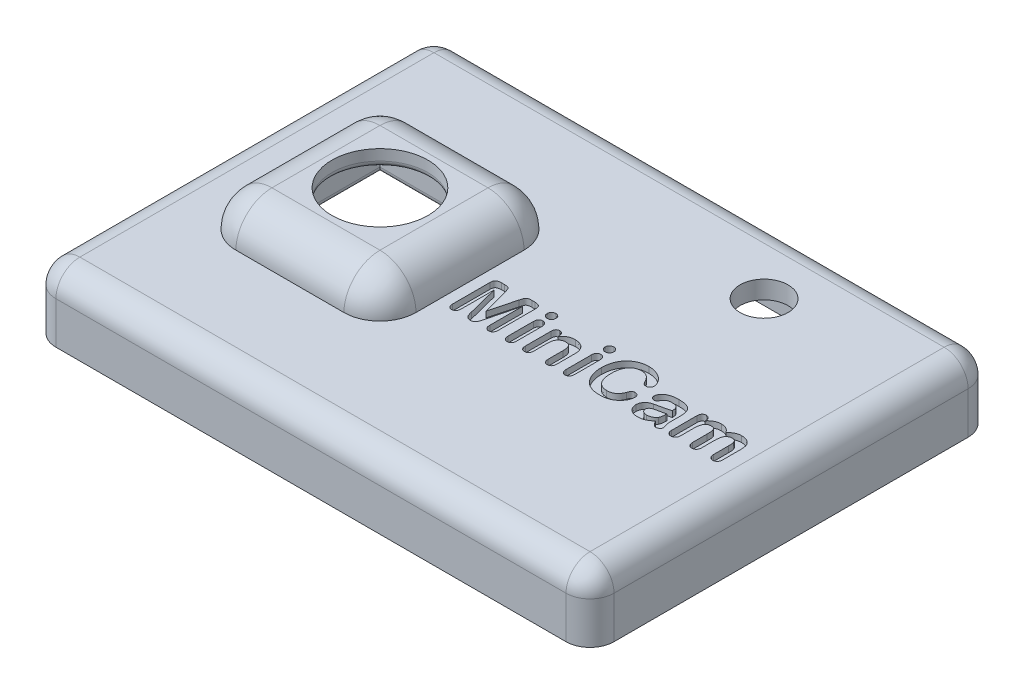
from build123d import *

# Parameters (mm, degrees)
SKETCH1_W           = 46.5
SKETCH1_H           = 33.5
BOSS_EXTRUDE2_DEPTH = 1.5
SKETCH2_W           = 15
SKETCH2_H           = 15
BOSS_EXTRUDE3_DEPTH = 3
SKETCH3_W           = 46.5
SKETCH3_H           = 33.5
SKETCH3_W_2         = 44.5
SKETCH3_H_2         = 31.5
BOSS_EXTRUDE4_DEPTH = 4
SKETCH4_W           = 5.010987107
SKETCH4_H           = 13
CUT_EXTRUDE1_DEPTH  = 3
FILLET2_R           = 2
SKETCH6_R           = 4
CUT_EXTRUDE2_DEPTH  = 13
FILLET3_R           = 3
SKETCH7_W           = 11
SKETCH7_H           = 11
CUT_EXTRUDE3_DEPTH  = 3.1
CUT_EXTRUDE4_DEPTH  = 0.5
SKETCH9_R           = 2
CUT_EXTRUDE5_DEPTH  = 10
FILLET4_R           = 0.5


with BuildPart() as part:
    # Sketch1 → Boss-Extrude2 (new body)
    with BuildSketch(Plane(origin=(0, 0, 0), x_dir=(1, 0, 0), z_dir=(0, 1, 0))):
        with Locations((-23.25, 16.75)):
            Rectangle(SKETCH1_W, SKETCH1_H)
    extrude(amount=BOSS_EXTRUDE2_DEPTH)

    # Sketch2 → Boss-Extrude3 (add)
    with BuildSketch(Plane(origin=(0, 1.5, 0), x_dir=(1, 0, 0), z_dir=(0, 1, 0))):
        with Locations((-34, 16.5)):
            Rectangle(SKETCH2_W, SKETCH2_H)
    extrude(amount=BOSS_EXTRUDE3_DEPTH)

    # Sketch3 → Boss-Extrude4 (add)
    with BuildSketch(Plane(origin=(0, 0, 0), x_dir=(-1, 0, 0), z_dir=(0, -1, 0))):
        with Locations((23.25, 16.75)):
            Rectangle(SKETCH3_W, SKETCH3_H)
        with Locations((23.25, 16.75)):
            Rectangle(SKETCH3_W_2, SKETCH3_H_2, mode=Mode.SUBTRACT)
    extrude(amount=BOSS_EXTRUDE4_DEPTH)

    # Sketch4 → Cut-Extrude1 (cut)
    with BuildSketch(Plane(origin=(0, -4, 0), x_dir=(-1, 0, 0), z_dir=(0, -1, 0))):
        with Locations((45.750314657, 16)):
            Rectangle(SKETCH4_W, SKETCH4_H)
    extrude(amount=-CUT_EXTRUDE1_DEPTH, mode=Mode.SUBTRACT)

    # Fillet2
    fillet2_edges = [part.edges().sort_by_distance(p)[0] for p in [
        (-46.5, 1.5, -16.75),
        (-23.25, 1.5, 0),
        (0, 1.5, -16.75),
        (0, -1.25, 0),
        (-46.5, -1.25, 0),
        (-46.5, -1.25, -33.5),
        (0, -1.25, -33.5),
        (-23.25, 1.5, -33.5),
    ]]
    fillet(fillet2_edges, radius=FILLET2_R)

    # Sketch6 → Cut-Extrude2 (cut)
    with BuildSketch(Plane(origin=(0, 4.5, 0), x_dir=(1, 0, 0), z_dir=(0, 1, 0))):
        with Locations(Location((-34, 16.5, 0), (0, 0, 270))):
            Circle(SKETCH6_R)
    extrude(amount=-CUT_EXTRUDE2_DEPTH, mode=Mode.SUBTRACT)

    # Fillet3
    fillet3_edges = [part.edges().sort_by_distance(p)[0] for p in [
        (-26.5, 3, -9),
        (-26.5, 3, -24),
        (-41.5, 3, -24),
        (-41.5, 3, -9),
        (-26.5, 4.5, -16.5),
        (-34, 4.5, -24),
        (-41.5, 4.5, -16.5),
        (-34, 4.5, -9),
    ]]
    fillet(fillet3_edges, radius=FILLET3_R - 0.0001)  # a hair under: the kernel refuses the full size

    # Sketch7 → Cut-Extrude3 (cut)
    with BuildSketch(Plane(origin=(0, 0, 0), x_dir=(-1, 0, 0), z_dir=(0, -1, 0))):
        with Locations((34, 16.5)):
            Rectangle(SKETCH7_W, SKETCH7_H)
    extrude(amount=-CUT_EXTRUDE3_DEPTH, mode=Mode.SUBTRACT)

    # Sketch8 → Cut-Extrude4 (cut)
    # profile 1 of 9: a face of its own
    with BuildSketch(Plane(origin=(0, 1.5, 0), x_dir=(1, 0, 0), z_dir=(0, 1, 0))):
        with BuildLine():
            Line((-24.231398083, 14.365616687), (-24.871069955, 16.886581996))
            Line((-24.871069955, 16.886581996), (-24.871069955, 14.155335595))
            add(Edge.make_bspline(
                [(-24.871069955, 14.155335595), (-24.872144816, 14.119646576), (-24.874157855, 14.052806889), (-24.892951756, 13.959414889), (-24.92224489, 13.879153638), (-24.966929559, 13.814081989), (-25.021234437, 13.763709705), (-25.084111377, 13.726985153), (-25.155738465, 13.705835842), (-25.206148804, 13.70322047), (-25.23223977, 13.701866827)],
                knots=[0, 0, 0, 0, 1.30362474, 2.441475632, 3.469867302, 4.406120522, 5.299256138, 6.158467928, 7.046875082, 8, 8, 8, 8], degree=3))
            add(Edge.make_bspline(
                [(-25.23223977, 13.701866827), (-25.257546406, 13.70320468), (-25.306674374, 13.705801864), (-25.37655805, 13.727495221), (-25.439162929, 13.762789105), (-25.493858224, 13.812489889), (-25.537566206, 13.87739824), (-25.569074288, 13.956615737), (-25.586859556, 14.050218499), (-25.589039671, 14.117267254), (-25.590199187, 14.152927796)],
                knots=[0, 0, 0, 0, 0.931401934, 1.808137819, 2.66942439, 3.563139973, 4.50699297, 5.529036112, 6.685793447, 8, 8, 8, 8], degree=3))
            Line((-25.590199187, 14.152927796), (-25.590199187, 17.2702246))
            add(Edge.make_bspline(
                [(-25.590199187, 17.2702246), (-25.589613584, 17.290832916), (-25.588485804, 17.33052136), (-25.583384758, 17.387542995), (-25.573000967, 17.439521751), (-25.557901866, 17.485762479), (-25.539019219, 17.526944117), (-25.516938501, 17.563503453), (-25.489307127, 17.594353515), (-25.446076919, 17.628051638), (-25.382966191, 17.660809577), (-25.297334195, 17.688914406), (-25.20024112, 17.705605359), (-25.131714998, 17.707467799), (-25.09579784, 17.708443975)],
                knots=[0, 0, 0, 0, 0.969665939, 1.867427353, 2.689218696, 3.457225703, 4.149776576, 4.816702983, 5.458338976, 6.085245707, 7.385799533, 8.77853966, 10.311509556, 12, 12, 12, 12], degree=3))
            Line((-25.09579784, 17.708443975), (-24.849399766, 17.708443975))
            add(Edge.make_bspline(
                [(-24.849399766, 17.708443975), (-24.81488062, 17.708017427), (-24.750836167, 17.707226038), (-24.662442675, 17.700766288), (-24.589333132, 17.688089163), (-24.529348352, 17.671086427), (-24.480270862, 17.645637251), (-24.438656353, 17.613427589), (-24.404366626, 17.572133518), (-24.376534891, 17.521402767), (-24.351700895, 17.458747845), (-24.325782433, 17.381620918), (-24.296563017, 17.288722766), (-24.278709765, 17.220819347), (-24.269120263, 17.184346444)],
                knots=[0, 0, 0, 0, 1.38803647, 2.575267475, 3.558583177, 4.368440808, 5.070869684, 5.768090105, 6.470518981, 7.212366556, 8.085347214, 9.177334938, 10.483864409, 12, 12, 12, 12], degree=3))
            Line((-24.269120263, 17.184346444), (-23.68964336, 15.037392543))
            Line((-23.68964336, 15.037392543), (-23.117389853, 17.184346444))
            add(Edge.make_bspline(
                [(-23.117389853, 17.184346444), (-23.10779668, 17.220817227), (-23.089936594, 17.288716699), (-23.060760639, 17.381639951), (-23.034716062, 17.45869404), (-23.010182407, 17.521674954), (-22.981217754, 17.571908916), (-22.947106116, 17.613461932), (-22.905418549, 17.64561686), (-22.856149832, 17.671256253), (-22.795539665, 17.688033341), (-22.721660642, 17.700772887), (-22.632727643, 17.707200069), (-22.56841821, 17.708009507), (-22.533899952, 17.708443975)],
                knots=[0, 0, 0, 0, 1.511478991, 2.813995637, 3.902629473, 4.772928891, 5.517843496, 6.218114959, 6.913193965, 7.613465427, 8.431097637, 9.421953472, 10.616226692, 12, 12, 12, 12], degree=3))
            Line((-22.533899952, 17.708443975), (-22.286699278, 17.708443975))
            add(Edge.make_bspline(
                [(-22.286699278, 17.708443975), (-22.250518455, 17.707458215), (-22.181468281, 17.705576918), (-22.08379193, 17.689038889), (-21.997965613, 17.660768626), (-21.934709851, 17.628142785), (-21.89162, 17.594089826), (-21.863008816, 17.563835347), (-21.841360692, 17.526674847), (-21.820875223, 17.486171147), (-21.80768569, 17.439201501), (-21.795486891, 17.387703255), (-21.790919798, 17.330491585), (-21.789713767, 17.290822739), (-21.789087533, 17.2702246)],
                knots=[0, 0, 0, 0, 1.69575107, 3.236297379, 4.624693315, 5.921190494, 6.546141798, 7.194208304, 7.859054455, 8.55478081, 9.316580419, 10.138397467, 11.033358612, 12, 12, 12, 12], degree=3))
            Line((-21.789087533, 17.2702246), (-21.789087533, 14.152927796))
            add(Edge.make_bspline(
                [(-21.789087533, 14.152927796), (-21.790193011, 14.117514262), (-21.792270673, 14.050957199), (-21.810780788, 13.957993159), (-21.84052216, 13.878215389), (-21.884679402, 13.813274684), (-21.939657805, 13.763504446), (-22.002959764, 13.726971383), (-22.075378632, 13.705840917), (-22.126309162, 13.703222058), (-22.152665147, 13.701866827)],
                knots=[0, 0, 0, 0, 1.293518314, 2.431070022, 3.450077594, 4.386084638, 5.272371044, 6.139835868, 7.037385671, 8, 8, 8, 8], degree=3))
            add(Edge.make_bspline(
                [(-22.152665147, 13.701866827), (-22.177695815, 13.703222721), (-22.226283009, 13.705854655), (-22.295654967, 13.727339561), (-22.357352233, 13.763943881), (-22.411626831, 13.814039422), (-22.456057981, 13.879332994), (-22.486595949, 13.95920682), (-22.505043479, 14.052840932), (-22.507112182, 14.119658426), (-22.508216765, 14.155335595)],
                knots=[0, 0, 0, 0, 0.922456205, 1.790585791, 2.649061979, 3.550299627, 4.495046019, 5.536376652, 6.684549498, 8, 8, 8, 8], degree=3))
            Line((-22.508216765, 14.155335595), (-22.508216765, 16.886581996))
            Line((-22.508216765, 16.886581996), (-23.147888637, 14.365616687))
            add(Edge.make_bspline(
                [(-23.147888637, 14.365616687), (-23.157627026, 14.327317769), (-23.175715324, 14.256180508), (-23.203115895, 14.158074331), (-23.227438928, 14.076294012), (-23.247750424, 14.007331113), (-23.272882075, 13.94801482), (-23.305066128, 13.893614071), (-23.347276204, 13.843158172), (-23.394844863, 13.793856593), (-23.453434224, 13.751926308), (-23.523143739, 13.72222774), (-23.603149658, 13.704454102), (-23.659849406, 13.70275805), (-23.68964336, 13.701866827)],
                knots=[0, 0, 0, 0, 1.501096557, 2.788170037, 3.868651286, 4.742863802, 5.516817816, 6.309819568, 7.133547599, 8.010237478, 8.906902995, 9.849006967, 10.869720086, 12, 12, 12, 12], degree=3))
            add(Edge.make_bspline(
                [(-23.68964336, 13.701866827), (-23.712435703, 13.702632983), (-23.756440934, 13.704112202), (-23.819578107, 13.715555548), (-23.87764711, 13.733857163), (-23.929908146, 13.760634965), (-23.976354874, 13.793466415), (-24.016826655, 13.831377345), (-24.05347845, 13.87170701), (-24.092991536, 13.933360051), (-24.13326311, 14.018085769), (-24.168949873, 14.128613878), (-24.198395145, 14.245928205), (-24.22027032, 14.325260734), (-24.231398083, 14.365616687)],
                knots=[0, 0, 0, 0, 0.868933015, 1.67765103, 2.439282522, 3.183205666, 3.908055228, 4.601401517, 5.295498424, 5.980457608, 7.386244959, 8.861049734, 10.403235965, 12, 12, 12, 12], degree=3))
        make_face()
    # profile 2 of 9: a face of its own
    with BuildSketch(Plane(origin=(0, 1.5, 0), x_dir=(1, 0, 0), z_dir=(0, 1, 0))):
        with BuildLine():
            Line((-20.248096322, 16.265369914), (-20.248096322, 14.147309599))
            add(Edge.make_bspline(
                [(-20.248096322, 14.147309599), (-20.249164779, 14.112696965), (-20.251180129, 14.047409772), (-20.270324536, 13.95604991), (-20.302400134, 13.877675602), (-20.347709943, 13.813392068), (-20.40337192, 13.763670561), (-20.466350043, 13.727317579), (-20.537026612, 13.705940928), (-20.5863821, 13.703247205), (-20.611673936, 13.701866827)],
                knots=[0, 0, 0, 0, 1.279660949, 2.41372764, 3.434282009, 4.393028164, 5.297478756, 6.175532382, 7.06506577, 8, 8, 8, 8], degree=3))
            add(Edge.make_bspline(
                [(-20.611673936, 13.701866827), (-20.637005782, 13.703109479), (-20.686007, 13.70551323), (-20.755642287, 13.728482731), (-20.817884806, 13.76506183), (-20.871425846, 13.816843739), (-20.915273381, 13.881635648), (-20.945373081, 13.959841713), (-20.963979087, 14.049593046), (-20.966102249, 14.113498849), (-20.967225554, 14.147309599)],
                knots=[0, 0, 0, 0, 0.944656094, 1.82731652, 2.710883517, 3.62364324, 4.589202842, 5.612771424, 6.736985008, 8, 8, 8, 8], degree=3))
            Line((-20.967225554, 14.147309599), (-20.967225554, 16.243699726))
            add(Edge.make_bspline(
                [(-20.967225554, 16.243699726), (-20.966076489, 16.277770004), (-20.963903818, 16.342190624), (-20.94575387, 16.432086867), (-20.915422398, 16.509303019), (-20.871374121, 16.571973401), (-20.81751051, 16.621176059), (-20.755527549, 16.656315602), (-20.68572724, 16.677038226), (-20.636964414, 16.6797237), (-20.611673936, 16.681116502)],
                knots=[0, 0, 0, 0, 1.282601348, 2.425162879, 3.437763456, 4.38569495, 5.284727511, 6.164859808, 7.048218153, 8, 8, 8, 8], degree=3))
            add(Edge.make_bspline(
                [(-20.611673936, 16.681116502), (-20.586398308, 16.679665431), (-20.53715054, 16.676838122), (-20.466444831, 16.656536299), (-20.403352363, 16.621009667), (-20.348506212, 16.57226924), (-20.302738217, 16.511554511), (-20.270824891, 16.438467689), (-20.251272564, 16.355206451), (-20.249188196, 16.296252386), (-20.248096322, 16.265369914)],
                knots=[0, 0, 0, 0, 0.975882645, 1.901438153, 2.812865763, 3.75006033, 4.717368935, 5.725761173, 6.808663735, 8, 8, 8, 8], degree=3))
        make_face()
    # profile 3 of 9: a face of its own
    with BuildSketch(Plane(origin=(0, 1.5, 0), x_dir=(1, 0, 0), z_dir=(0, 1, 0))):
        with BuildLine():
            add(Edge.make_bspline(
                [(-20.60364794, 17.040681117), (-20.627841882, 17.041627599), (-20.675049001, 17.043474371), (-20.743185254, 17.061926987), (-20.805563946, 17.092096493), (-20.862253505, 17.132762148), (-20.909373693, 17.18530569), (-20.943903491, 17.248905411), (-20.964101999, 17.322521946), (-20.966156554, 17.374701521), (-20.967225554, 17.401850932)],
                knots=[0, 0, 0, 0, 1.006201835, 1.963296869, 2.915511555, 3.880878732, 4.85189213, 5.829536295, 6.870691953, 8, 8, 8, 8], degree=3))
            add(Edge.make_bspline(
                [(-20.967225554, 17.401850932), (-20.965805846, 17.426867502), (-20.963054456, 17.475349555), (-20.942474039, 17.544940343), (-20.907090963, 17.606757892), (-20.859526624, 17.660492967), (-20.802988558, 17.703804357), (-20.741286734, 17.737235971), (-20.673750653, 17.756054145), (-20.627300888, 17.75854299), (-20.60364794, 17.759810349)],
                knots=[0, 0, 0, 0, 1.057408726, 2.04925565, 3.037480321, 4.047814229, 5.064214746, 6.036169889, 6.999986943, 8, 8, 8, 8], degree=3))
            add(Edge.make_bspline(
                [(-20.60364794, 17.759810349), (-20.580796309, 17.758790724), (-20.536042678, 17.756793844), (-20.470917486, 17.73909696), (-20.410300924, 17.709909184), (-20.35500091, 17.669646946), (-20.306112494, 17.619441329), (-20.272743761, 17.555559585), (-20.250652676, 17.482220749), (-20.248978587, 17.429588658), (-20.248096322, 17.401850932)],
                knots=[0, 0, 0, 0, 0.967133894, 1.894077239, 2.837452275, 3.803721558, 4.782485793, 5.777084342, 6.828497526, 8, 8, 8, 8], degree=3))
            add(Edge.make_bspline(
                [(-20.248096322, 17.401850932), (-20.249129813, 17.374948742), (-20.251115667, 17.323256138), (-20.271807314, 17.250565271), (-20.304928621, 17.186612971), (-20.352503998, 17.134715376), (-20.407490403, 17.093189341), (-20.468405807, 17.062811407), (-20.534234381, 17.043312277), (-20.580234772, 17.041568607), (-20.60364794, 17.040681117)],
                knots=[0, 0, 0, 0, 1.133982342, 2.178948973, 3.165031597, 4.149752721, 5.126395816, 6.06160272, 7.013399203, 8, 8, 8, 8], degree=3))
        make_face()
    # profile 4 of 9: a face of its own
    with BuildSketch(Plane(origin=(0, 1.5, 0), x_dir=(1, 0, 0), z_dir=(0, 1, 0))):
        with BuildLine():
            Line((-18.854783436, 16.276606309), (-18.854783436, 16.188320354))
            add(Edge.make_bspline(
                [(-18.854783436, 16.188320354), (-18.82210193, 16.228581587), (-18.758760839, 16.306613194), (-18.653947943, 16.409408158), (-18.543833521, 16.494474445), (-18.428863095, 16.563947214), (-18.30623326, 16.616857465), (-18.175986582, 16.65422292), (-18.036963436, 16.677503612), (-17.941519581, 16.679890017), (-17.892466528, 16.681116502)],
                knots=[0, 0, 0, 0, 1.105863122, 2.14330934, 3.124116013, 4.06884223, 5.002046541, 5.964948147, 6.954091843, 8, 8, 8, 8], degree=3))
            add(Edge.make_bspline(
                [(-17.892466528, 16.681116502), (-17.844750757, 16.679575709), (-17.751405788, 16.676561501), (-17.615391833, 16.65291377), (-17.48722877, 16.613349136), (-17.367743996, 16.558240515), (-17.259428988, 16.488504127), (-17.163605777, 16.406053148), (-17.08396375, 16.308699069), (-17.043574665, 16.235558132), (-17.023251173, 16.198754149)],
                knots=[0, 0, 0, 0, 1.092012857, 2.136272848, 3.149533556, 4.155305525, 5.139051171, 6.089806823, 7.038804796, 8, 8, 8, 8], degree=3))
            add(Edge.make_bspline(
                [(-17.023251173, 16.198754149), (-17.01173529, 16.176251332), (-16.988678335, 16.131196481), (-16.963885735, 16.059111331), (-16.943221561, 15.985257176), (-16.929903579, 15.906937133), (-16.920286862, 15.822257911), (-16.914320327, 15.728232241), (-16.910239816, 15.623593568), (-16.90961192, 15.550258307), (-16.909282032, 15.5117289)],
                knots=[0, 0, 0, 0, 0.860987887, 1.723858877, 2.59364755, 3.474136303, 4.429262975, 5.499190641, 6.686106779, 8, 8, 8, 8], degree=3))
            Line((-16.909282032, 15.5117289), (-16.909282032, 14.147309599))
            add(Edge.make_bspline(
                [(-16.909282032, 14.147309599), (-16.910436916, 14.112713652), (-16.912613451, 14.047512899), (-16.930634019, 13.956098893), (-16.962081819, 13.877997502), (-17.005591572, 13.813528533), (-17.059788191, 13.763488177), (-17.121905032, 13.727360913), (-17.192027773, 13.70584881), (-17.241140213, 13.703220641), (-17.266438849, 13.701866827)],
                knots=[0, 0, 0, 0, 1.287683965, 2.426814984, 3.449942892, 4.403315466, 5.298703094, 6.173625539, 7.059204068, 8, 8, 8, 8], degree=3))
            add(Edge.make_bspline(
                [(-17.266438849, 13.701866827), (-17.2922963, 13.703121789), (-17.342326496, 13.705549947), (-17.413380958, 13.728275801), (-17.476613441, 13.765040838), (-17.530990691, 13.816773994), (-17.575587518, 13.881571225), (-17.606759992, 13.959663526), (-17.625098987, 14.049616592), (-17.627265188, 14.113506996), (-17.628411264, 14.147309599)],
                knots=[0, 0, 0, 0, 0.956888113, 1.851431539, 2.73651156, 3.649202174, 4.61265493, 5.631794413, 6.747049533, 8, 8, 8, 8], degree=3))
            Line((-17.628411264, 14.147309599), (-17.628411264, 15.369668773))
            add(Edge.make_bspline(
                [(-17.628411264, 15.369668773), (-17.628699095, 15.399104502), (-17.629256853, 15.456144939), (-17.634113197, 15.538893649), (-17.642024646, 15.616314233), (-17.653201671, 15.68838396), (-17.66714728, 15.755358131), (-17.686144678, 15.816476445), (-17.706565101, 15.872806705), (-17.73050034, 15.924065949), (-17.759566757, 15.969902828), (-17.795209079, 16.010017833), (-17.838292726, 16.042816941), (-17.887349542, 16.069626429), (-17.942498886, 16.090355512), (-18.004115876, 16.105721888), (-18.072284302, 16.114148418), (-18.119847881, 16.115425133), (-18.144482799, 16.116086391)],
                knots=[0, 0, 0, 0, 1.347407926, 2.611001687, 3.793088521, 4.908587076, 5.948729011, 6.92120119, 7.835727118, 8.690310665, 9.505642719, 10.312189108, 11.132838799, 11.971477223, 12.863082387, 13.822511078, 14.872198764, 16, 16, 16, 16], degree=3))
            add(Edge.make_bspline(
                [(-18.144482799, 16.116086391), (-18.177510238, 16.114738452), (-18.242693736, 16.112078137), (-18.338187257, 16.089548738), (-18.4288188, 16.052228293), (-18.513477124, 16.000683463), (-18.591043571, 15.937608325), (-18.65732342, 15.861572941), (-18.713681529, 15.775289929), (-18.740703429, 15.711261993), (-18.754458487, 15.678669615)],
                knots=[0, 0, 0, 0, 0.990651567, 1.955166231, 2.927741695, 3.922358355, 4.92102128, 5.916966927, 6.939665927, 8, 8, 8, 8], degree=3))
            add(Edge.make_bspline(
                [(-18.754458487, 15.678669615), (-18.758951947, 15.66347496), (-18.768640479, 15.630713144), (-18.779565189, 15.576201838), (-18.788920603, 15.512971604), (-18.797123186, 15.440715187), (-18.801985193, 15.359527495), (-18.807376003, 15.269674565), (-18.809327743, 15.170899521), (-18.809663051, 15.102135249), (-18.809837859, 15.066286128)],
                knots=[0, 0, 0, 0, 0.61625433, 1.3287312, 2.16048812, 3.103078273, 4.156926102, 5.324424499, 6.605132795, 8, 8, 8, 8], degree=3))
            Line((-18.809837859, 15.066286128), (-18.809837859, 14.147309599))
            add(Edge.make_bspline(
                [(-18.809837859, 14.147309599), (-18.810841725, 14.112406466), (-18.812728423, 14.046808364), (-18.832553464, 13.955309915), (-18.862687442, 13.876138915), (-18.909026551, 13.812587903), (-18.963922757, 13.762980393), (-19.027103751, 13.72710629), (-19.097979725, 13.705950528), (-19.14785746, 13.703250406), (-19.173415472, 13.701866827)],
                knots=[0, 0, 0, 0, 1.287446969, 2.41967039, 3.443922091, 4.393062967, 5.2960435, 6.159191247, 7.056745165, 8, 8, 8, 8], degree=3))
            add(Edge.make_bspline(
                [(-19.173415472, 13.701866827), (-19.198464983, 13.703150855), (-19.247169411, 13.705647425), (-19.316484595, 13.728226993), (-19.378131324, 13.765597991), (-19.432472224, 13.816476234), (-19.475983599, 13.881869871), (-19.507380913, 13.959615965), (-19.525635491, 14.04963071), (-19.527814329, 14.113511881), (-19.52896709, 14.147309599)],
                knots=[0, 0, 0, 0, 0.935579112, 1.81907128, 2.69486961, 3.615758504, 4.582227965, 5.61052191, 6.735794854, 8, 8, 8, 8], degree=3))
            Line((-19.52896709, 14.147309599), (-19.52896709, 16.265369914))
            add(Edge.make_bspline(
                [(-19.52896709, 16.265369914), (-19.528061503, 16.298103673), (-19.526355118, 16.359783394), (-19.509378642, 16.445557666), (-19.483018632, 16.519227766), (-19.44259433, 16.5784523), (-19.392385748, 16.62455323), (-19.333779618, 16.657984286), (-19.266433394, 16.677918216), (-19.219036016, 16.680019251), (-19.194283062, 16.681116502)],
                knots=[0, 0, 0, 0, 1.29464202, 2.439474141, 3.448837032, 4.371523091, 5.248813216, 6.126614955, 7.021637581, 8, 8, 8, 8], degree=3))
            add(Edge.make_bspline(
                [(-19.194283062, 16.681116502), (-19.178737096, 16.680395254), (-19.148506093, 16.678992701), (-19.10405068, 16.67102306), (-19.06230106, 16.656297778), (-19.022639119, 16.636364156), (-18.986641178, 16.610146478), (-18.952481384, 16.579840858), (-18.925335033, 16.541107084), (-18.899678587, 16.498692441), (-18.880187895, 16.450099047), (-18.864228785, 16.397090826), (-18.856964488, 16.338331838), (-18.855530637, 16.297752694), (-18.854783436, 16.276606309)],
                knots=[0, 0, 0, 0, 0.943175954, 1.834119198, 2.726833115, 3.619252164, 4.515056339, 5.421956296, 6.372636641, 7.36874147, 8.423244244, 9.537454901, 10.716731755, 12, 12, 12, 12], degree=3))
        make_face()
    # profile 5 of 9: a face of its own
    with BuildSketch(Plane(origin=(0, 1.5, 0), x_dir=(1, 0, 0), z_dir=(0, 1, 0))):
        with BuildLine():
            Line((-15.419657195, 16.265369914), (-15.419657195, 14.147309599))
            add(Edge.make_bspline(
                [(-15.419657195, 14.147309599), (-15.420725652, 14.112696965), (-15.422741002, 14.047409772), (-15.441885408, 13.95604991), (-15.473961006, 13.877675602), (-15.519270816, 13.813392068), (-15.574932792, 13.763670561), (-15.637910915, 13.727317579), (-15.708587485, 13.705940928), (-15.757942973, 13.703247205), (-15.783234808, 13.701866827)],
                knots=[0, 0, 0, 0, 1.279660949, 2.41372764, 3.434282009, 4.393028164, 5.297478756, 6.175532382, 7.06506577, 8, 8, 8, 8], degree=3))
            add(Edge.make_bspline(
                [(-15.783234808, 13.701866827), (-15.808566654, 13.703109479), (-15.857567873, 13.70551323), (-15.92720316, 13.728482731), (-15.989445679, 13.76506183), (-16.042986718, 13.816843739), (-16.086834253, 13.881635648), (-16.116933953, 13.959841713), (-16.13553996, 14.049593046), (-16.137663122, 14.113498849), (-16.138786426, 14.147309599)],
                knots=[0, 0, 0, 0, 0.944656094, 1.82731652, 2.710883517, 3.62364324, 4.589202842, 5.612771424, 6.736985008, 8, 8, 8, 8], degree=3))
            Line((-16.138786426, 14.147309599), (-16.138786426, 16.243699726))
            add(Edge.make_bspline(
                [(-16.138786426, 16.243699726), (-16.137637361, 16.277770004), (-16.13546469, 16.342190624), (-16.117314743, 16.432086867), (-16.086983271, 16.509303019), (-16.042934993, 16.571973401), (-15.989071383, 16.621176059), (-15.927088422, 16.656315602), (-15.857288112, 16.677038226), (-15.808525286, 16.6797237), (-15.783234808, 16.681116502)],
                knots=[0, 0, 0, 0, 1.282601348, 2.425162879, 3.437763456, 4.38569495, 5.284727511, 6.164859808, 7.048218153, 8, 8, 8, 8], degree=3))
            add(Edge.make_bspline(
                [(-15.783234808, 16.681116502), (-15.757959181, 16.679665431), (-15.708711412, 16.676838122), (-15.638005703, 16.656536299), (-15.574913235, 16.621009667), (-15.520067084, 16.57226924), (-15.474299089, 16.511554511), (-15.442385764, 16.438467689), (-15.422833436, 16.355206451), (-15.420749069, 16.296252386), (-15.419657195, 16.265369914)],
                knots=[0, 0, 0, 0, 0.975882645, 1.901438153, 2.812865763, 3.75006033, 4.717368935, 5.725761173, 6.808663735, 8, 8, 8, 8], degree=3))
        make_face()
    # profile 6 of 9: a face of its own
    with BuildSketch(Plane(origin=(0, 1.5, 0), x_dir=(1, 0, 0), z_dir=(0, 1, 0))):
        with BuildLine():
            add(Edge.make_bspline(
                [(-15.775208813, 17.040681117), (-15.799402754, 17.041627599), (-15.846609873, 17.043474371), (-15.914746127, 17.061926987), (-15.977124818, 17.092096493), (-16.033814378, 17.132762148), (-16.080934566, 17.18530569), (-16.115464363, 17.248905411), (-16.135662872, 17.322521946), (-16.137717427, 17.374701521), (-16.138786426, 17.401850932)],
                knots=[0, 0, 0, 0, 1.006201835, 1.963296869, 2.915511555, 3.880878732, 4.85189213, 5.829536295, 6.870691953, 8, 8, 8, 8], degree=3))
            add(Edge.make_bspline(
                [(-16.138786426, 17.401850932), (-16.137366719, 17.426867502), (-16.134615328, 17.475349555), (-16.114034912, 17.544940343), (-16.078651836, 17.606757892), (-16.031087497, 17.660492967), (-15.974549431, 17.703804357), (-15.912847607, 17.737235971), (-15.845311525, 17.756054145), (-15.79886176, 17.75854299), (-15.775208813, 17.759810349)],
                knots=[0, 0, 0, 0, 1.057408726, 2.04925565, 3.037480321, 4.047814229, 5.064214746, 6.036169889, 6.999986943, 8, 8, 8, 8], degree=3))
            add(Edge.make_bspline(
                [(-15.775208813, 17.759810349), (-15.752357182, 17.758790724), (-15.70760355, 17.756793844), (-15.642478358, 17.73909696), (-15.581861796, 17.709909184), (-15.526561782, 17.669646946), (-15.477673366, 17.619441329), (-15.444304633, 17.555559585), (-15.422213548, 17.482220749), (-15.420539459, 17.429588658), (-15.419657195, 17.401850932)],
                knots=[0, 0, 0, 0, 0.967133894, 1.894077239, 2.837452275, 3.803721558, 4.782485793, 5.777084342, 6.828497526, 8, 8, 8, 8], degree=3))
            add(Edge.make_bspline(
                [(-15.419657195, 17.401850932), (-15.420690685, 17.374948742), (-15.422676539, 17.323256138), (-15.443368186, 17.250565271), (-15.476489493, 17.186612971), (-15.524064871, 17.134715376), (-15.579051275, 17.093189341), (-15.639966679, 17.062811407), (-15.705795254, 17.043312277), (-15.751795644, 17.041568607), (-15.775208813, 17.040681117)],
                knots=[0, 0, 0, 0, 1.133982342, 2.178948973, 3.165031597, 4.149752721, 5.126395816, 6.06160272, 7.013399203, 8, 8, 8, 8], degree=3))
        make_face()
    # profile 7 of 9: a face of its own
    with BuildSketch(Plane(origin=(0, 1.5, 0), x_dir=(1, 0, 0), z_dir=(0, 1, 0))):
        with BuildLine():
            add(Edge.make_bspline(
                [(-11.256573126, 15.012511956), (-11.257663292, 14.980598818), (-11.259914184, 14.914706981), (-11.278844402, 14.814474795), (-11.307835843, 14.710189473), (-11.349058288, 14.603062517), (-11.401410318, 14.493791263), (-11.469276403, 14.38577003), (-11.549592237, 14.27824099), (-11.643093502, 14.172540262), (-11.749945232, 14.072204175), (-11.872072205, 13.98154434), (-12.007733533, 13.900942323), (-12.156753818, 13.829940395), (-12.319045098, 13.771560189), (-12.495544291, 13.731433051), (-12.684451706, 13.705915682), (-12.81486758, 13.703240538), (-12.881837294, 13.701866827)],
                knots=[0, 0, 0, 0, 0.663733519, 1.370426865, 2.116139696, 2.914458905, 3.756161797, 4.633801399, 5.564768272, 6.546895284, 7.567232022, 8.609557965, 9.705783212, 10.846455846, 12.040496113, 13.287086875, 14.606894913, 16, 16, 16, 16], degree=3))
            add(Edge.make_bspline(
                [(-12.881837294, 13.701866827), (-12.932961809, 13.702296399), (-13.032935035, 13.70313642), (-13.179410129, 13.71516903), (-13.319076707, 13.732273549), (-13.451923651, 13.75687067), (-13.57819871, 13.790092193), (-13.698315412, 13.830942605), (-13.813222094, 13.879026337), (-13.921981986, 13.936227855), (-14.025656486, 14.002876737), (-14.124903896, 14.078289381), (-14.220743959, 14.162831351), (-14.279158681, 14.225967217), (-14.308859363, 14.258068342)],
                knots=[0, 0, 0, 0, 1.162398207, 2.273052359, 3.340187725, 4.361698781, 5.343118899, 6.307107414, 7.245071305, 8.173155143, 9.098082292, 10.044846171, 11.00591152, 12, 12, 12, 12], degree=3))
            add(Edge.make_bspline(
                [(-14.308859363, 14.258068342), (-14.334652544, 14.29014811), (-14.386351463, 14.354447635), (-14.457495211, 14.456776242), (-14.520924591, 14.565621508), (-14.581208362, 14.678435194), (-14.632677794, 14.797425027), (-14.678588006, 14.920001913), (-14.71745107, 15.046728073), (-14.748217385, 15.177681623), (-14.773741925, 15.312278589), (-14.789577533, 15.451265868), (-14.801975025, 15.593639712), (-14.802829389, 15.690144575), (-14.80326071, 15.738864584)],
                knots=[0, 0, 0, 0, 0.929575355, 1.863207229, 2.811429804, 3.773642551, 4.750392879, 5.73698116, 6.729013264, 7.741753443, 8.774044155, 9.821085133, 10.899985467, 12, 12, 12, 12], degree=3))
            add(Edge.make_bspline(
                [(-14.80326071, 15.738864584), (-14.801682773, 15.81733594), (-14.798603575, 15.970465532), (-14.77123358, 16.193517612), (-14.72879494, 16.404457381), (-14.666696233, 16.602129788), (-14.588474638, 16.786899204), (-14.495859279, 16.958533372), (-14.386220374, 17.1155109), (-14.262796593, 17.258395291), (-14.125975177, 17.386279594), (-13.977877744, 17.498401543), (-13.818465772, 17.593697715), (-13.648939242, 17.672347358), (-13.470971711, 17.733563538), (-13.286881815, 17.779223746), (-13.096929433, 17.806109803), (-12.968334152, 17.809478511), (-12.903507483, 17.811176723)],
                knots=[0, 0, 0, 0, 1.192086909, 2.32624733, 3.409866705, 4.457877143, 5.469000883, 6.455088314, 7.416011801, 8.372962001, 9.319325461, 10.256879636, 11.190511563, 12.136385829, 13.091719595, 14.046248446, 15.015086683, 16, 16, 16, 16], degree=3))
            add(Edge.make_bspline(
                [(-12.903507483, 17.811176723), (-12.863898161, 17.810498256), (-12.785651869, 17.809157977), (-12.669857804, 17.800369938), (-12.557366725, 17.784985893), (-12.448057722, 17.764105141), (-12.34200009, 17.737986864), (-12.239421734, 17.704661454), (-12.1401925, 17.665609323), (-12.044902112, 17.620325894), (-11.95368221, 17.5718156), (-11.867912818, 17.519471142), (-11.787172307, 17.465051523), (-11.71236352, 17.406856634), (-11.642571329, 17.346404978), (-11.579073772, 17.282315827), (-11.519898181, 17.216730812), (-11.46762912, 17.147725142), (-11.420206699, 17.078649277), (-11.380058062, 17.009108339), (-11.34569036, 16.94097283), (-11.315855284, 16.874210323), (-11.294486437, 16.807605922), (-11.279222184, 16.742085155), (-11.268871993, 16.677697609), (-11.267623948, 16.634871245), (-11.267006921, 16.613698136)],
                knots=[0, 0, 0, 0, 1.284700242, 2.537862918, 3.763812693, 4.965289083, 6.145935712, 7.303948861, 8.460888676, 9.602102237, 10.724019168, 11.810373379, 12.859709494, 13.88027226, 14.88267171, 15.852117704, 16.804758353, 17.745428632, 18.657571087, 19.520770973, 20.347343408, 21.132381758, 21.889741149, 22.611674871, 23.313620019, 24, 24, 24, 24], degree=3))
            add(Edge.make_bspline(
                [(-11.267006921, 16.613698136), (-11.268356801, 16.591393416), (-11.271018655, 16.547410297), (-11.288881495, 16.483032606), (-11.321464286, 16.424145053), (-11.363271768, 16.370016525), (-11.413988285, 16.32446163), (-11.47122108, 16.290831815), (-11.533857005, 16.269363673), (-11.577707274, 16.267250796), (-11.60008575, 16.266172514)],
                knots=[0, 0, 0, 0, 1.005202555, 1.982178884, 2.979908251, 4.019228851, 5.052378826, 6.030321538, 6.994797445, 8, 8, 8, 8], degree=3))
            add(Edge.make_bspline(
                [(-11.60008575, 16.266172514), (-11.624224587, 16.267082654), (-11.669988988, 16.268808172), (-11.734113089, 16.281915556), (-11.788626641, 16.305361382), (-11.834858304, 16.33960674), (-11.874556567, 16.386885113), (-11.916007523, 16.44479118), (-11.960247389, 16.515849197), (-11.988594652, 16.568574372), (-12.003793344, 16.596843545)],
                knots=[0, 0, 0, 0, 1.03602979, 1.964190893, 2.792215287, 3.564084538, 4.410155262, 5.430272824, 6.62221301, 8, 8, 8, 8], degree=3))
            add(Edge.make_bspline(
                [(-12.003793344, 16.596843545), (-12.030094544, 16.644267451), (-12.080834835, 16.735757677), (-12.170328499, 16.858528646), (-12.266906251, 16.962276029), (-12.371022426, 17.047967833), (-12.485844386, 17.114318787), (-12.612232039, 17.162147118), (-12.751476608, 17.189242773), (-12.848011127, 17.192893799), (-12.897889286, 17.194780239)],
                knots=[0, 0, 0, 0, 1.14083101, 2.200891824, 3.189077095, 4.117958574, 5.028926365, 5.968284059, 6.950238216, 8, 8, 8, 8], degree=3))
            add(Edge.make_bspline(
                [(-12.897889286, 17.194780239), (-12.938102501, 17.193898679), (-13.017102807, 17.192166825), (-13.132167892, 17.17269181), (-13.24126752, 17.14370557), (-13.343687153, 17.100954152), (-13.440289969, 17.047487774), (-13.530108393, 16.980797166), (-13.613146315, 16.902027101), (-13.690239382, 16.812237493), (-13.759186808, 16.711052197), (-13.818477172, 16.599395458), (-13.869550214, 16.478405951), (-13.90966768, 16.346656966), (-13.943275861, 16.205295268), (-13.964641457, 16.053204485), (-13.978702219, 15.891624274), (-13.980483622, 15.780632063), (-13.981398731, 15.723615192)],
                knots=[0, 0, 0, 0, 0.93671651, 1.840213212, 2.713397844, 3.56368846, 4.421020421, 5.281885359, 6.164466969, 7.084649485, 8.036264718, 9.013062724, 10.027939462, 11.093339593, 12.220621858, 13.412469407, 14.670781518, 16, 16, 16, 16], degree=3))
            add(Edge.make_bspline(
                [(-13.981398731, 15.723615192), (-13.980809421, 15.685085634), (-13.979658838, 15.609859627), (-13.974375931, 15.499232095), (-13.963951033, 15.393723471), (-13.949226398, 15.293131096), (-13.932141805, 15.197293182), (-13.909612148, 15.106755441), (-13.882860072, 15.021091238), (-13.852935882, 14.940135233), (-13.817595571, 14.864621154), (-13.781435503, 14.792896716), (-13.740457608, 14.726738387), (-13.694807832, 14.666706879), (-13.64776744, 14.609841828), (-13.596407786, 14.558580705), (-13.541452185, 14.512625413), (-13.464277158, 14.457925759), (-13.359730372, 14.401509461), (-13.223939086, 14.353028491), (-13.077878788, 14.323396918), (-12.976953411, 14.320003942), (-12.925177672, 14.318263311)],
                knots=[0, 0, 0, 0, 1.161576005, 2.267888061, 3.337585273, 4.356077319, 5.33204537, 6.270922222, 7.166254778, 8.036538097, 8.870177389, 9.678142996, 10.45692397, 11.2117863, 11.950096439, 12.68003429, 13.395618977, 14.107193223, 15.528992878, 16.960094082, 18.440497528, 20, 20, 20, 20], degree=3))
            add(Edge.make_bspline(
                [(-12.925177672, 14.318263311), (-12.896790194, 14.318559401), (-12.840939073, 14.319141943), (-12.759220388, 14.328657745), (-12.680535695, 14.341962777), (-12.605512539, 14.36139054), (-12.53320853, 14.38511345), (-12.465139495, 14.416145764), (-12.3996762, 14.451360903), (-12.337730494, 14.492263727), (-12.279886507, 14.539254983), (-12.225254877, 14.590829317), (-12.173376859, 14.646736709), (-12.127179605, 14.70928993), (-12.083454531, 14.776125531), (-12.043550733, 14.848296798), (-12.007165722, 14.925456579), (-11.986836458, 14.979452556), (-11.976504958, 15.006893759)],
                knots=[0, 0, 0, 0, 1.080453892, 2.125745732, 3.129130718, 4.117609764, 5.07455133, 6.023212249, 6.962414916, 7.903439618, 8.845456672, 9.796903999, 10.763291339, 11.745501622, 12.754406698, 13.803416246, 14.883677954, 16, 16, 16, 16], degree=3))
            add(Edge.make_bspline(
                [(-11.976504958, 15.006893759), (-11.967794482, 15.032454122), (-11.950967431, 15.081832081), (-11.920455223, 15.150747458), (-11.887308439, 15.212255834), (-11.851941427, 15.267613808), (-11.806952346, 15.313714117), (-11.749685015, 15.346567107), (-11.680885932, 15.364723708), (-11.631764364, 15.366905872), (-11.605703948, 15.368063574)],
                knots=[0, 0, 0, 0, 1.148264852, 2.218238262, 3.200956292, 4.119438462, 5.004604087, 5.912235567, 6.892380428, 8, 8, 8, 8], degree=3))
            add(Edge.make_bspline(
                [(-11.605703948, 15.368063574), (-11.582539833, 15.366912276), (-11.536975641, 15.364647653), (-11.47168448, 15.344136692), (-11.410756678, 15.312775984), (-11.358032684, 15.267380372), (-11.312604175, 15.214331771), (-11.279979498, 15.152711087), (-11.259938146, 15.084643443), (-11.257715435, 15.036998125), (-11.256573126, 15.012511956)],
                knots=[0, 0, 0, 0, 1.000050397, 1.967115494, 2.935635085, 3.946684534, 4.957733984, 5.941906876, 6.942292355, 8, 8, 8, 8], degree=3))
        make_face()
    # profile 8 of 9: a face of its own
    with BuildSketch(Plane(origin=(0, 1.5, 0), x_dir=(1, 0, 0), z_dir=(0, 1, 0))):
        with BuildLine():
            add(Edge.make_bspline(
                [(-8.693070039, 14.144099201), (-8.736581596, 14.10912344), (-8.820820722, 14.041409762), (-8.949540225, 13.950337219), (-9.077497218, 13.875591536), (-9.202929901, 13.810749892), (-9.332282733, 13.761562337), (-9.467742929, 13.727405528), (-9.610829072, 13.705917229), (-9.708815899, 13.703237255), (-9.758922293, 13.701866827)],
                knots=[0, 0, 0, 0, 1.134976623, 2.197334357, 3.202049815, 4.145906015, 5.065227011, 6.008518778, 6.98163919, 8, 8, 8, 8], degree=3))
            add(Edge.make_bspline(
                [(-9.758922293, 13.701866827), (-9.804468041, 13.703334376), (-9.893075506, 13.706189436), (-10.021833259, 13.726017205), (-10.141461013, 13.761194842), (-10.252726179, 13.807623284), (-10.351948328, 13.868850421), (-10.441727177, 13.937407657), (-10.517467547, 14.017972553), (-10.581053594, 14.106525103), (-10.632177094, 14.201836144), (-10.666937921, 14.303055125), (-10.690007448, 14.407654505), (-10.69262813, 14.478927847), (-10.693950814, 14.514900211)],
                knots=[0, 0, 0, 0, 1.184162322, 2.303741301, 3.375788211, 4.419755653, 5.427788172, 6.399029855, 7.348633904, 8.290666782, 9.22726528, 10.149049303, 11.065806787, 12, 12, 12, 12], degree=3))
            add(Edge.make_bspline(
                [(-10.693950814, 14.514900211), (-10.693293727, 14.53900543), (-10.69199703, 14.586574713), (-10.682916357, 14.656658377), (-10.66857165, 14.72407135), (-10.64874556, 14.788820985), (-10.621502229, 14.850253792), (-10.589771907, 14.909608619), (-10.551778993, 14.965997869), (-10.508248367, 15.01919286), (-10.459376455, 15.068623621), (-10.406183664, 15.114417759), (-10.349030974, 15.156925888), (-10.286268983, 15.193024124), (-10.220015269, 15.226495271), (-10.149454597, 15.255243245), (-10.074287346, 15.279497659), (-10.022269387, 15.291900028), (-9.995689172, 15.29823741)],
                knots=[0, 0, 0, 0, 1.012663371, 1.998391732, 2.964047332, 3.906191245, 4.83754432, 5.783101931, 6.730861852, 7.689425638, 8.667109729, 9.647375169, 10.636622286, 11.654512663, 12.685048125, 13.753803465, 14.852235092, 16, 16, 16, 16], degree=3))
            add(Edge.make_bspline(
                [(-9.995689172, 15.29823741), (-9.988729867, 15.299827537), (-9.972660827, 15.303499144), (-9.945482476, 15.310139574), (-9.911643635, 15.317050038), (-9.871532782, 15.325965795), (-9.825083026, 15.336594268), (-9.771737187, 15.347606694), (-9.712159487, 15.360568536), (-9.625312213, 15.37823782), (-9.517444987, 15.401577931), (-9.393675568, 15.429855769), (-9.279716037, 15.456380639), (-9.137368056, 15.489778151), (-8.959133144, 15.538284769), (-8.816320417, 15.580475073), (-8.742028614, 15.602422654)],
                knots=[0, 0, 0, 0, 0.232329118, 0.536448125, 0.910439712, 1.356195672, 1.873725596, 2.461167299, 3.128879386, 3.858027181, 5.345481019, 6.720537632, 7.989865364, 9.153499714, 11.478829411, 14, 14, 14, 14], degree=3))
            add(Edge.make_bspline(
                [(-8.742028614, 15.602422654), (-8.744926618, 15.648033362), (-8.750355661, 15.733479251), (-8.774419764, 15.851325467), (-8.808110274, 15.95042874), (-8.847236416, 16.019679477), (-8.88668743, 16.064813411), (-8.924153883, 16.091978112), (-8.967349101, 16.116161983), (-9.017688938, 16.135253608), (-9.074822022, 16.149566766), (-9.138760644, 16.159592923), (-9.209547152, 16.166049993), (-9.258887701, 16.166972363), (-9.284585936, 16.167452765)],
                knots=[0, 0, 0, 0, 1.801419441, 3.374731284, 4.730208451, 5.917792687, 6.485835615, 7.081173764, 7.733231515, 8.434998629, 9.197926469, 10.053449113, 10.986170169, 12, 12, 12, 12], degree=3))
            add(Edge.make_bspline(
                [(-9.284585936, 16.167452765), (-9.328237095, 16.166648924), (-9.409928522, 16.165144568), (-9.524149395, 16.151190795), (-9.621388828, 16.127226308), (-9.703212871, 16.091844842), (-9.772500148, 16.045566615), (-9.835517587, 15.991351167), (-9.893915268, 15.927332293), (-9.943930151, 15.855758599), (-9.987028141, 15.785907742), (-10.026291155, 15.727849834), (-10.057948968, 15.682541247), (-10.082882207, 15.647125823), (-10.112991683, 15.621617627), (-10.153648831, 15.60765331), (-10.204696761, 15.598055886), (-10.242822357, 15.597248048), (-10.263757435, 15.596804457)],
                knots=[0, 0, 0, 0, 1.730029857, 3.237682849, 4.552246778, 5.687340174, 6.752276824, 7.84289086, 8.976595884, 10.177521142, 11.29850292, 12.231030561, 12.954841406, 13.491597218, 13.943837149, 14.491383102, 15.171606116, 16, 16, 16, 16], degree=3))
            add(Edge.make_bspline(
                [(-10.263757435, 15.596804457), (-10.283659015, 15.597621889), (-10.322745196, 15.599227305), (-10.378867893, 15.615111084), (-10.430563872, 15.640766456), (-10.477409117, 15.674737283), (-10.517480034, 15.716814347), (-10.544631431, 15.767175145), (-10.562694775, 15.822188173), (-10.564570374, 15.860977645), (-10.56553488, 15.880924711)],
                knots=[0, 0, 0, 0, 1.031881618, 2.026588354, 3.002473553, 4.017176394, 5.020391663, 5.991017057, 6.966902257, 8, 8, 8, 8], degree=3))
            add(Edge.make_bspline(
                [(-10.56553488, 15.880924711), (-10.563747322, 15.913193851), (-10.560131792, 15.978461668), (-10.532959832, 16.075030117), (-10.489681578, 16.169824887), (-10.429745244, 16.262742163), (-10.351543741, 16.35185545), (-10.252368933, 16.431579664), (-10.13498202, 16.503554551), (-9.999136697, 16.566516334), (-9.844979432, 16.618905995), (-9.672258598, 16.654861667), (-9.482370743, 16.677666813), (-9.34966795, 16.679935338), (-9.280572938, 16.681116502)],
                knots=[0, 0, 0, 0, 0.693344763, 1.402364581, 2.141402337, 2.928236833, 3.772078734, 4.679713396, 5.65372995, 6.72710891, 7.893418274, 9.147220965, 10.514629608, 12, 12, 12, 12], degree=3))
            add(Edge.make_bspline(
                [(-9.280572938, 16.681116502), (-9.241504781, 16.680904086), (-9.165465179, 16.680490655), (-9.054389347, 16.674522984), (-8.949707843, 16.665929543), (-8.851359186, 16.654133371), (-8.759689553, 16.638229615), (-8.674543125, 16.618102649), (-8.595719301, 16.594932467), (-8.522843806, 16.568589834), (-8.45587703, 16.537768881), (-8.393586313, 16.503696246), (-8.337576885, 16.463763866), (-8.285392459, 16.421263866), (-8.238922826, 16.373836804), (-8.197477608, 16.321940562), (-8.161763968, 16.265697318), (-8.129806477, 16.205795354), (-8.103747946, 16.140929639), (-8.080281618, 16.071566066), (-8.060431662, 15.997314562), (-8.044230682, 15.918002362), (-8.032526062, 15.833521211), (-8.023905133, 15.744084992), (-8.017900885, 15.649589375), (-8.017491601, 15.585042838), (-8.017281185, 15.55185888)],
                knots=[0, 0, 0, 0, 1.416357497, 2.756701798, 4.031895873, 5.224227726, 6.346935823, 7.403363909, 8.394728739, 9.324579844, 10.210062332, 11.065549018, 11.894388556, 12.700436969, 13.50297572, 14.296790965, 15.104005874, 15.915406284, 16.754849262, 17.635216391, 18.569358246, 19.539569097, 20.568427353, 21.660073491, 22.797022642, 24, 24, 24, 24], degree=3))
            add(Edge.make_bspline(
                [(-8.017281185, 15.55185888), (-8.017305065, 15.510658856), (-8.017350965, 15.431469199), (-8.017036113, 15.317497865), (-8.018083845, 15.213161628), (-8.019154737, 15.083675947), (-8.020403895, 14.918871744), (-8.022039088, 14.785643212), (-8.022899382, 14.715550108)],
                knots=[0, 0, 0, 0, 0.886727532, 1.704359412, 2.452917786, 3.13238276, 4.491312708, 6, 6, 6, 6], degree=3))
            add(Edge.make_bspline(
                [(-8.022899382, 14.715550108), (-8.022279652, 14.680715994), (-8.021025929, 14.610246081), (-8.005698139, 14.503988986), (-7.985928643, 14.395004235), (-7.954993477, 14.288759356), (-7.924855824, 14.191590701), (-7.902922023, 14.109788211), (-7.88858501, 14.047994264), (-7.88591143, 14.012779513), (-7.884852253, 13.998828675)],
                knots=[0, 0, 0, 0, 1.140222205, 2.306685874, 3.511631769, 4.766144111, 5.927988888, 6.844283719, 7.542146094, 8, 8, 8, 8], degree=3))
            add(Edge.make_bspline(
                [(-7.884852253, 13.998828675), (-7.886068078, 13.980462235), (-7.888537148, 13.943164102), (-7.909933203, 13.889093695), (-7.944990962, 13.838729673), (-7.990910025, 13.792352606), (-8.045133944, 13.752931104), (-8.104516186, 13.723598242), (-8.167563755, 13.704713099), (-8.21111005, 13.702824181), (-8.233180474, 13.701866827)],
                knots=[0, 0, 0, 0, 0.875490473, 1.777925396, 2.735475759, 3.793375106, 4.882946873, 5.923706805, 6.947679186, 8, 8, 8, 8], degree=3))
            add(Edge.make_bspline(
                [(-8.233180474, 13.701866827), (-8.252361059, 13.703356276), (-8.29155424, 13.706399783), (-8.349264293, 13.729171093), (-8.405974895, 13.76522554), (-8.461323413, 13.816549499), (-8.517307738, 13.880541471), (-8.574558521, 13.957351347), (-8.635256172, 14.04539276), (-8.673167044, 14.110118534), (-8.693070039, 14.144099201)],
                knots=[0, 0, 0, 0, 0.69255206, 1.41514551, 2.215225972, 3.112878123, 4.134275469, 5.28776696, 6.576092927, 8, 8, 8, 8], degree=3))
        make_face()
        with BuildLine():
            add(Edge.make_bspline(
                [(-8.742028614, 15.140125291), (-8.771893241, 15.130417312), (-8.837499169, 15.109091048), (-8.946743369, 15.082462282), (-9.073650553, 15.052268631), (-9.211895465, 15.023597487), (-9.347656922, 14.997714819), (-9.465959064, 14.972319967), (-9.561148774, 14.952675777), (-9.636326821, 14.935462071), (-9.699738141, 14.917328837), (-9.757376832, 14.89199162), (-9.814020005, 14.860535725), (-9.867793857, 14.822851882), (-9.916837312, 14.778423371), (-9.949671545, 14.721318732), (-9.972086358, 14.657539536), (-9.973888209, 14.611688154), (-9.974821583, 14.587936773)],
                knots=[0, 0, 0, 0, 1.043778459, 2.292948605, 3.736417067, 5.381553527, 6.986495406, 8.331558736, 9.404494451, 10.217909516, 10.896108744, 11.593406189, 12.306191046, 13.046581941, 13.776316077, 14.482633103, 15.213991881, 16, 16, 16, 16], degree=3))
            add(Edge.make_bspline(
                [(-9.974821583, 14.587936773), (-9.973351309, 14.562848245), (-9.97044933, 14.513329329), (-9.944988559, 14.442746136), (-9.904177331, 14.378470049), (-9.848994147, 14.321191781), (-9.780648872, 14.273668984), (-9.700842344, 14.23993558), (-9.611837036, 14.218424182), (-9.5490394, 14.216517438), (-9.516537217, 14.215530564)],
                knots=[0, 0, 0, 0, 0.912631232, 1.801321635, 2.700078131, 3.673090839, 4.682645268, 5.713983264, 6.816825957, 8, 8, 8, 8], degree=3))
            add(Edge.make_bspline(
                [(-9.516537217, 14.215530564), (-9.480613219, 14.216544441), (-9.409962349, 14.21853841), (-9.306429791, 14.236281449), (-9.206937163, 14.263288456), (-9.113270619, 14.301506679), (-9.027455858, 14.348470377), (-8.952716015, 14.402635789), (-8.889772166, 14.463588443), (-8.857462142, 14.509800246), (-8.841550963, 14.532557402)],
                knots=[0, 0, 0, 0, 1.110475693, 2.183945986, 3.240049226, 4.294302585, 5.305515011, 6.258963075, 7.142620573, 8, 8, 8, 8], degree=3))
            add(Edge.make_bspline(
                [(-8.841550963, 14.532557402), (-8.833433116, 14.546289895), (-8.816452975, 14.575014218), (-8.797152599, 14.623925321), (-8.778960553, 14.678366384), (-8.766303582, 14.739632613), (-8.754355259, 14.806421259), (-8.748042653, 14.879730382), (-8.742759122, 14.959195768), (-8.742278209, 15.014373373), (-8.742028614, 15.04301074)],
                knots=[0, 0, 0, 0, 0.726422996, 1.519462499, 2.391443271, 3.341603541, 4.368558488, 5.484230519, 6.694306944, 8, 8, 8, 8], degree=3))
            Line((-8.742028614, 15.04301074), (-8.742028614, 15.140125291))
        make_face(mode=Mode.SUBTRACT)
    # profile 9 of 9: a face of its own
    with BuildSketch(Plane(origin=(0, 1.5, 0), x_dir=(1, 0, 0), z_dir=(0, 1, 0))):
        with BuildLine():
            Line((-4.838184213, 15.14173049), (-4.838184213, 14.16496679))
            add(Edge.make_bspline(
                [(-4.838184213, 14.16496679), (-4.839215242, 14.128751838), (-4.841165859, 14.060236367), (-4.860853691, 13.964416849), (-4.89458711, 13.882823415), (-4.941904487, 13.816113745), (-5.000718288, 13.764982243), (-5.068440191, 13.727659961), (-5.145309887, 13.705669222), (-5.19947832, 13.703161528), (-5.227445014, 13.701866827)],
                knots=[0, 0, 0, 0, 1.266235822, 2.395605666, 3.402519793, 4.335311923, 5.231091892, 6.106879557, 7.022598298, 8, 8, 8, 8], degree=3))
            add(Edge.make_bspline(
                [(-5.227445014, 13.701866827), (-5.254623569, 13.703138637), (-5.307244049, 13.705600993), (-5.382090127, 13.728029769), (-5.44860365, 13.764984154), (-5.506590188, 13.816185178), (-5.553140271, 13.882893181), (-5.585807047, 13.96460156), (-5.60576531, 14.060211584), (-5.607672004, 14.128743268), (-5.608679818, 14.16496679)],
                knots=[0, 0, 0, 0, 0.958914139, 1.856556456, 2.73282327, 3.630465587, 4.567111465, 5.580438649, 6.721102017, 8, 8, 8, 8], degree=3))
            Line((-5.608679818, 14.16496679), (-5.608679818, 15.33595959))
            add(Edge.make_bspline(
                [(-5.608679818, 15.33595959), (-5.608637427, 15.379573147), (-5.608557564, 15.461738965), (-5.613080059, 15.57705097), (-5.617999429, 15.676955046), (-5.626414317, 15.762846485), (-5.639881972, 15.838021725), (-5.660184126, 15.905482774), (-5.690414737, 15.965454553), (-5.72818554, 16.018924425), (-5.776808719, 16.063664078), (-5.839007185, 16.094543735), (-5.91263211, 16.112836767), (-5.965720903, 16.114958884), (-5.993927621, 16.116086391)],
                knots=[0, 0, 0, 0, 1.575587637, 2.968330436, 4.168822722, 5.189306973, 6.084130096, 6.924849853, 7.72456167, 8.499892968, 9.280149342, 10.084230406, 10.982128442, 12, 12, 12, 12], degree=3))
            add(Edge.make_bspline(
                [(-5.993927621, 16.116086391), (-6.022857177, 16.115308272), (-6.078275768, 16.113817677), (-6.157530968, 16.102797573), (-6.229116499, 16.083624338), (-6.293293938, 16.056237702), (-6.349906238, 16.02105091), (-6.398372779, 15.977459216), (-6.438765808, 15.926278732), (-6.471709605, 15.867464861), (-6.498686067, 15.8017106), (-6.521831814, 15.729465548), (-6.540772169, 15.650499438), (-6.556785442, 15.565048242), (-6.569684874, 15.472940643), (-6.578056386, 15.373802953), (-6.584026764, 15.268079326), (-6.584432312, 15.195246352), (-6.584640919, 15.157782482)],
                knots=[0, 0, 0, 0, 1.072726865, 2.054957592, 2.959985853, 3.813338004, 4.633692391, 5.420603725, 6.218633423, 7.040726042, 7.912341107, 8.850536995, 9.851629862, 10.921921998, 12.073946012, 13.299226168, 14.610774249, 16, 16, 16, 16], degree=3))
            Line((-6.584640919, 15.157782482), (-6.584640919, 14.16496679))
            add(Edge.make_bspline(
                [(-6.584640919, 14.16496679), (-6.585607623, 14.128998473), (-6.587428869, 14.06123511), (-6.607812536, 13.966562536), (-6.640213944, 13.884861369), (-6.687603721, 13.818146327), (-6.745192926, 13.765658104), (-6.812429428, 13.728912898), (-6.887542959, 13.705360317), (-6.940812899, 13.703055429), (-6.968283522, 13.701866827)],
                knots=[0, 0, 0, 0, 1.267438716, 2.387821237, 3.399536605, 4.347850497, 5.250359179, 6.125232187, 7.033206341, 8, 8, 8, 8], degree=3))
            add(Edge.make_bspline(
                [(-6.968283522, 13.701866827), (-6.995446924, 13.703181683), (-7.048294995, 13.705739816), (-7.12393958, 13.727843126), (-7.190799034, 13.76588913), (-7.250039003, 13.817163048), (-7.297889324, 13.884054092), (-7.33115595, 13.965661025), (-7.352574334, 14.060340453), (-7.354248593, 14.128183907), (-7.355136524, 14.16416419)],
                knots=[0, 0, 0, 0, 0.955872848, 1.859709514, 2.746023205, 3.64789137, 4.600178314, 5.613935963, 6.734568273, 8, 8, 8, 8], degree=3))
            Line((-7.355136524, 14.16416419), (-7.355136524, 16.264567315))
            add(Edge.make_bspline(
                [(-7.355136524, 16.264567315), (-7.353884747, 16.297015072), (-7.351515444, 16.358430659), (-7.334524173, 16.444818799), (-7.303796388, 16.518985748), (-7.260685031, 16.580051452), (-7.207725422, 16.628751897), (-7.145595257, 16.662506612), (-7.07586157, 16.683787105), (-7.026768776, 16.685725002), (-7.001190105, 16.686734699)],
                knots=[0, 0, 0, 0, 1.249103234, 2.364243825, 3.370552077, 4.316533519, 5.220766453, 6.115207027, 7.017972001, 8, 8, 8, 8], degree=3))
            add(Edge.make_bspline(
                [(-7.001190105, 16.686734699), (-6.976459735, 16.68552779), (-6.928664527, 16.683195255), (-6.859817024, 16.664248814), (-6.798149515, 16.631349841), (-6.743472834, 16.587146628), (-6.697358219, 16.532143493), (-6.665438294, 16.465639948), (-6.645578909, 16.39010623), (-6.643510277, 16.33666673), (-6.642428089, 16.308710292)],
                knots=[0, 0, 0, 0, 1.012533589, 1.956875484, 2.898540199, 3.857472998, 4.823338609, 5.81384557, 6.856331155, 8, 8, 8, 8], degree=3))
            Line((-6.642428089, 16.308710292), (-6.642428089, 16.238884128))
            add(Edge.make_bspline(
                [(-6.642428089, 16.238884128), (-6.61056796, 16.275231718), (-6.54869876, 16.345815119), (-6.445545856, 16.436184), (-6.341125696, 16.513982073), (-6.231397201, 16.575401254), (-6.117312952, 16.623420306), (-5.997381807, 16.657148593), (-5.871314493, 16.677796423), (-5.78506432, 16.679995691), (-5.74110875, 16.681116502)],
                knots=[0, 0, 0, 0, 1.114688582, 2.164614282, 3.159066809, 4.115906851, 5.059923563, 6.010102619, 6.985891047, 8, 8, 8, 8], degree=3))
            add(Edge.make_bspline(
                [(-5.74110875, 16.681116502), (-5.696090734, 16.67967129), (-5.608797508, 16.676868918), (-5.482484972, 16.656915715), (-5.366064417, 16.622527331), (-5.259432808, 16.573706021), (-5.1618518, 16.51136477), (-5.074006354, 16.434320451), (-4.994866826, 16.343251047), (-4.951268371, 16.274296431), (-4.928877966, 16.238884128)],
                knots=[0, 0, 0, 0, 1.11017006, 2.152700925, 3.14437276, 4.0951572, 5.035997559, 5.99009648, 6.967794802, 8, 8, 8, 8], degree=3))
            add(Edge.make_bspline(
                [(-4.928877966, 16.238884128), (-4.897360515, 16.274481213), (-4.835960306, 16.343829096), (-4.736643758, 16.435858338), (-4.632769391, 16.511771624), (-4.526237026, 16.574777731), (-4.413987384, 16.622773061), (-4.296306028, 16.65586691), (-4.173130384, 16.678110049), (-4.08892403, 16.680101698), (-4.046018418, 16.681116502)],
                knots=[0, 0, 0, 0, 1.115453128, 2.173051866, 3.170174304, 4.129679404, 5.07202097, 6.025901206, 6.994138649, 8, 8, 8, 8], degree=3))
            add(Edge.make_bspline(
                [(-4.046018418, 16.681116502), (-3.996702712, 16.679871894), (-3.900736471, 16.677449942), (-3.762456832, 16.654678063), (-3.634638618, 16.617606446), (-3.517954851, 16.566618725), (-3.41342408, 16.50127063), (-3.322497045, 16.422754263), (-3.245311515, 16.330977097), (-3.206735542, 16.261274527), (-3.187236858, 16.226042535)],
                knots=[0, 0, 0, 0, 1.152917475, 2.24352777, 3.267398485, 4.25932605, 5.212614232, 6.139888987, 7.05978478, 8, 8, 8, 8], degree=3))
            add(Edge.make_bspline(
                [(-3.187236858, 16.226042535), (-3.179363273, 16.20852984), (-3.162736903, 16.171548908), (-3.144648101, 16.110379236), (-3.127088965, 16.042864938), (-3.115053775, 15.967816855), (-3.10464987, 15.885915522), (-3.096299835, 15.796804828), (-3.09287316, 15.700367048), (-3.092118391, 15.633725146), (-3.091727507, 15.599212256)],
                knots=[0, 0, 0, 0, 0.72077696, 1.522039022, 2.392527629, 3.341243788, 4.375000762, 5.495464012, 6.702936508, 8, 8, 8, 8], degree=3))
            Line((-3.091727507, 15.599212256), (-3.091727507, 14.16496679))
            add(Edge.make_bspline(
                [(-3.091727507, 14.16496679), (-3.092757344, 14.128750443), (-3.094705704, 14.060232331), (-3.114408521, 13.964430346), (-3.148093387, 13.882780105), (-3.195455446, 13.816425148), (-3.253498935, 13.764717445), (-3.32100578, 13.727882143), (-3.397209883, 13.705625068), (-3.450871627, 13.703146609), (-3.478580509, 13.701866827)],
                knots=[0, 0, 0, 0, 1.270260722, 2.40322042, 3.413335159, 4.349092294, 5.240672226, 6.119243699, 7.028849044, 8, 8, 8, 8], degree=3))
            add(Edge.make_bspline(
                [(-3.478580509, 13.701866827), (-3.505517444, 13.703071573), (-3.55799787, 13.705418744), (-3.632256463, 13.729066547), (-3.699362931, 13.765852839), (-3.757574359, 13.818089319), (-3.806010109, 13.884600916), (-3.837975647, 13.96670148), (-3.859747936, 14.061102115), (-3.861365336, 14.12897232), (-3.862223113, 14.16496679)],
                knots=[0, 0, 0, 0, 0.949562486, 1.850004283, 2.726333282, 3.637390661, 4.592775282, 5.606174378, 6.730451973, 8, 8, 8, 8], degree=3))
            Line((-3.862223113, 14.16496679), (-3.862223113, 15.400167557))
            add(Edge.make_bspline(
                [(-3.862223113, 15.400167557), (-3.862708821, 15.437618845), (-3.863631843, 15.508789831), (-3.865699749, 15.609800381), (-3.873810543, 15.698825099), (-3.881433839, 15.777386044), (-3.895745079, 15.84772642), (-3.918588474, 15.911432773), (-3.951897421, 15.968677234), (-3.992325212, 16.020825833), (-4.044499394, 16.064446581), (-4.10916203, 16.095420864), (-4.185340026, 16.112487301), (-4.239625876, 16.114841316), (-4.268338505, 16.116086391)],
                knots=[0, 0, 0, 0, 1.423520235, 2.705203094, 3.837439621, 4.819854604, 5.703211107, 6.558808119, 7.378494985, 8.210510543, 9.055347959, 9.937474934, 10.909098471, 12, 12, 12, 12], degree=3))
            add(Edge.make_bspline(
                [(-4.268338505, 16.116086391), (-4.292772756, 16.114965538), (-4.341366923, 16.112736416), (-4.413373311, 16.095847562), (-4.48327156, 16.068390869), (-4.550351347, 16.030634086), (-4.612745989, 15.984330672), (-4.668790497, 15.929994622), (-4.717476279, 15.867858985), (-4.743268417, 15.821642278), (-4.756319055, 15.798256954)],
                knots=[0, 0, 0, 0, 0.958008278, 1.905260523, 2.885719617, 3.896064096, 4.916337823, 5.9258641, 6.95050202, 8, 8, 8, 8], degree=3))
            add(Edge.make_bspline(
                [(-4.756319055, 15.798256954), (-4.763057464, 15.781512539), (-4.777580568, 15.745423772), (-4.793701191, 15.685353913), (-4.807290609, 15.616408548), (-4.817970703, 15.538630264), (-4.827971632, 15.451992292), (-4.834129572, 15.356373016), (-4.83690784, 15.251971014), (-4.837747447, 15.179454001), (-4.838184213, 15.14173049)],
                knots=[0, 0, 0, 0, 0.650583702, 1.402184857, 2.238696194, 3.184464858, 4.2331, 5.384065679, 6.63918517, 8, 8, 8, 8], degree=3))
        make_face()
    extrude(amount=-CUT_EXTRUDE4_DEPTH, mode=Mode.SUBTRACT)

    # Sketch9 → Cut-Extrude5 (cut)
    with BuildSketch(Plane(origin=(0, 1.5, 0), x_dir=(1, 0, 0), z_dir=(0, 1, 0))):
        with Locations(Location((-13, 27.5, 0), (0, 0, 270))):
            Circle(SKETCH9_R)
    extrude(amount=-CUT_EXTRUDE5_DEPTH, mode=Mode.SUBTRACT)

    # Fillet4
    fillet4_edges = [part.edges().sort_by_distance(p)[0] for p in [
        (-34, 3.1, -20.5),
        (-28.5, 0, -16.5),
        (-34, 0, -11),
        (-39.5, 0, -16.5),
        (-34, 0, -22),
    ]]
    fillet(fillet4_edges, radius=FILLET4_R)


solid = part.part
